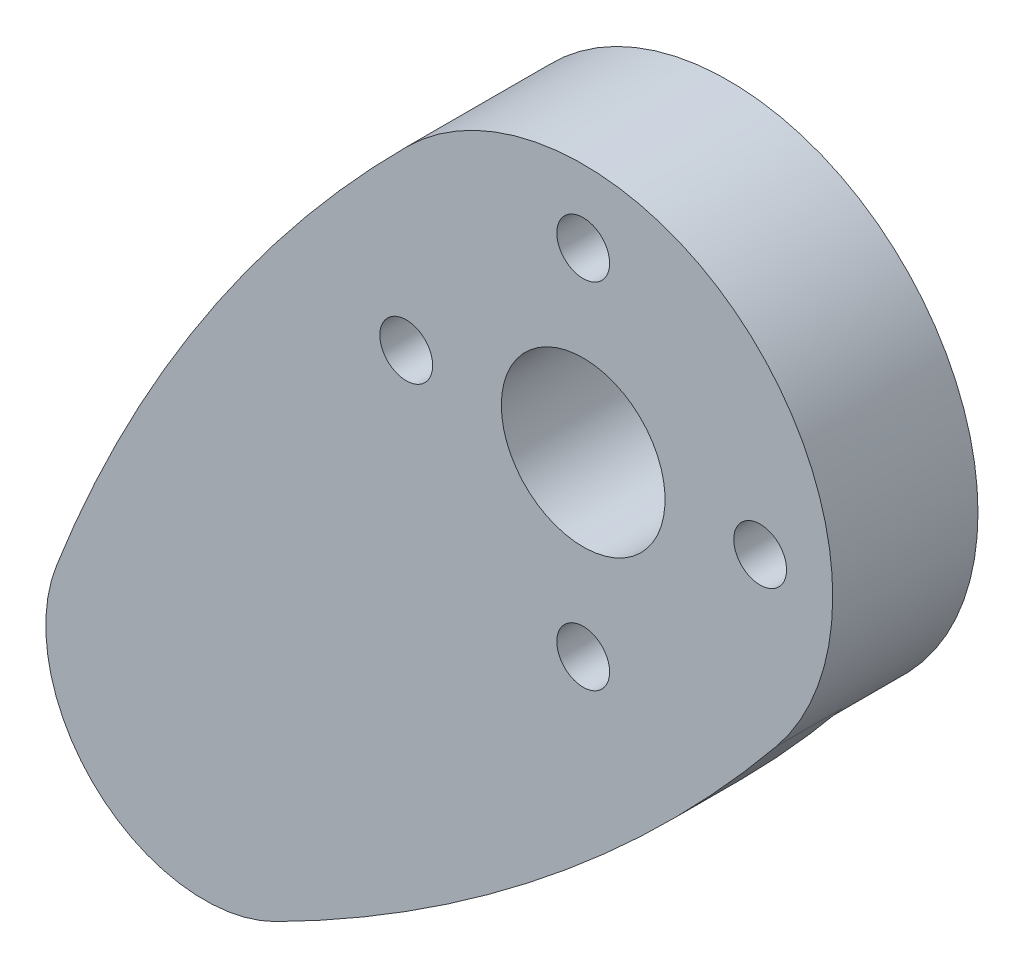
from build123d import *
from build123d.topology import SkipClean

# Parameters (mm, degrees)
BOSS_EXTRUDE1_DEPTH = 3.175
BOSS_EXTRUDE2_START = 3.81
SKETCH2_R           = 12
BOSS_EXTRUDE2_DEPTH = 3.81
SKETCH3_R           = 3.937
CUT_EXTRUDE1_DEPTH  = 134.099089527
SKETCH4_R           = 1.27
CUT_EXTRUDE2_DEPTH  = 134.099089527


with BuildPart() as part:
    # Sketch1 → Boss-Extrude1 (new body)
    with BuildSketch(Plane.XY):
        with BuildLine():
            ThreePointArc((113.784062988, 44.416608597), (112.542436022, 60.902914722), (96.014300162, 60.502100346))
            ThreePointArc((96.014300162, 60.502100346), (86.225733854, 48.445051897), (79.156979953, 34.616777747))
            ThreePointArc((79.156979953, 34.616777747), (81.153408489, 26.227218543), (89.699693339, 25.073335615))
            ThreePointArc((89.699693339, 25.073335615), (102.758092485, 33.479680479), (113.784062988, 44.416608597))
        make_face()
    extrude(amount=BOSS_EXTRUDE1_DEPTH)

    # Sketch2 → Boss-Extrude2 (add)
    with SkipClean():  # the faces are left unmerged after this step: merging them gives an invalid solid
        with BuildSketch(Plane(origin=(0, 0, 0), x_dir=(-1, 0, 0), z_dir=(0, 0, -1)).offset(BOSS_EXTRUDE2_START)):
            with Locations((-104.48925, 52.0065)):
                Circle(SKETCH2_R)
        extrude(amount=-BOSS_EXTRUDE2_DEPTH)

    # Sketch3 → Cut-Extrude1 (cut, through all)
    with SkipClean():  # the faces are left unmerged after this step: merging them gives an invalid solid
        with BuildSketch(Plane(origin=(0, 0, -3.81), x_dir=(-1, 0, 0), z_dir=(0, 0, -1))):
            with Locations((-104.48925, 52.0065)):
                Circle(SKETCH3_R)
        extrude(amount=-CUT_EXTRUDE1_DEPTH, mode=Mode.SUBTRACT)

    # Sketch4 → Cut-Extrude2 (cut, through all)
    with SkipClean():  # the faces are left unmerged after this step: merging them gives an invalid solid
        with BuildSketch(Plane(origin=(0, 0, -3.81), x_dir=(-1, 0, 0), z_dir=(0, 0, -1))):
            with Locations((-95.98025, 52.0065)):
                Circle(SKETCH4_R)
            with Locations((-112.99825, 52.0065)):
                Circle(SKETCH4_R)
            with Locations((-104.48925, 43.4975)):
                Circle(SKETCH4_R)
            with Locations((-104.48925, 60.5155)):
                Circle(SKETCH4_R)
        extrude(amount=-CUT_EXTRUDE2_DEPTH, mode=Mode.SUBTRACT)


solid = part.part
